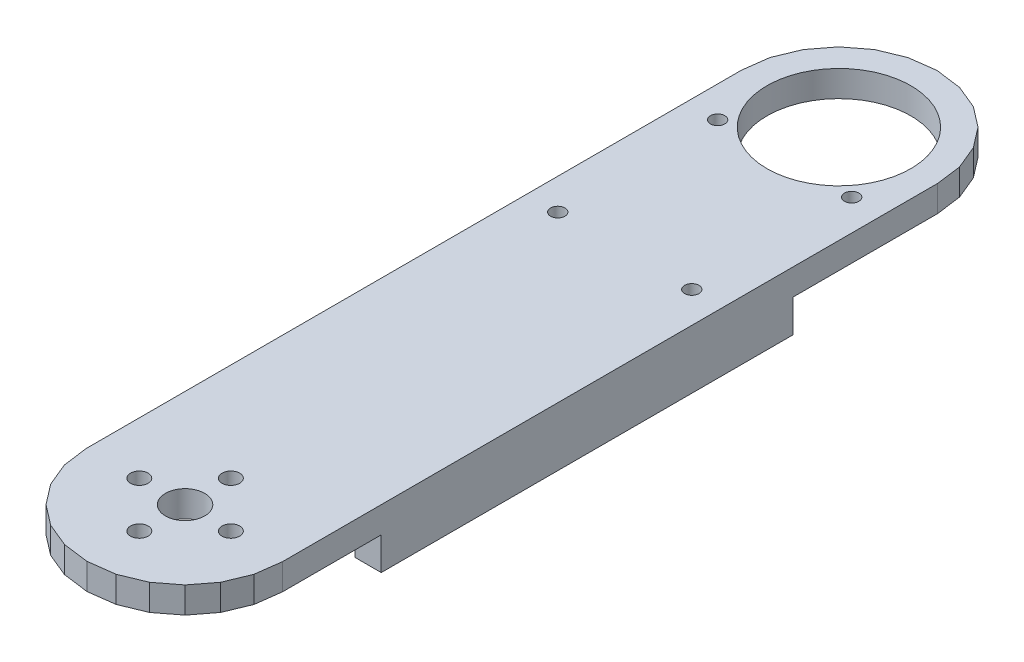
from build123d import *

# Parameters (mm, degrees)
BOSS_1_DEPTH  = 4
S_BOX2_W      = 4
S_BOX2_H      = 5.5
BOSS_2_DEPTH  = 63
S_BOX3_W      = 4
S_BOX3_H      = 5.5
BOSS_3_DEPTH  = 63
S_HOLE4_R     = 3
HOLE_4_DEPTH  = 4.2
S_HOLE5_R     = 1.35
HOLE_5_DEPTH  = 4.2
S_HOLE6_R     = 1.35
HOLE_6_DEPTH  = 4.2
S_HOLE7_R     = 1.35
HOLE_7_DEPTH  = 4.2
S_HOLE8_R     = 1.35
HOLE_8_DEPTH  = 4.2
S_HOLE9_R     = 11
HOLE_9_DEPTH  = 4.2
S_HOLE10_R    = 1.1
HOLE_10_DEPTH = 4.2
S_HOLE11_R    = 1.1
HOLE_11_DEPTH = 4.2
S_HOLE12_R    = 1.1
HOLE_12_DEPTH = 4.2
S_HOLE13_R    = 1.1
HOLE_13_DEPTH = 4.2


with BuildPart() as part:
    # S_prism1 → Boss_1 (new body)
    with BuildSketch(Plane(origin=(0, -20, 0), x_dir=(1, 0, 0), z_dir=(0, 1, 0))):
        Polygon((-15, -0.1), (-14.492, -3.956), (-13.004, -7.55), (-10.636, -10.636), (-7.55, -13.004), (-3.956, -14.492), (-0.1, -15), (0.1, -15), (3.956, -14.492), (7.55, -13.004), (10.636, -10.636), (13.004, -7.55), (14.492, -3.956), (15, -0.1), (15, 100.1), (14.492, 103.956), (13.004, 107.55), (10.636, 110.636), (7.55, 113.004), (3.956, 114.492), (0.1, 115), (-0.1, 115), (-3.956, 114.492), (-7.55, 113.004), (-10.636, 110.636), (-13.004, 107.55), (-14.492, 103.956), (-15, 100.1), align=None)
    extrude(amount=BOSS_1_DEPTH)

    # S_box2 → Boss_2 (add)
    with BuildSketch(Plane.XY.offset(-78)):
        with Locations((-13, -22.25)):
            Rectangle(S_BOX2_W, S_BOX2_H)
    extrude(amount=BOSS_2_DEPTH)

    # S_box3 → Boss_3 (add)
    with BuildSketch(Plane.XY.offset(-78)):
        with Locations((13, -22.25)):
            Rectangle(S_BOX3_W, S_BOX3_H)
    extrude(amount=BOSS_3_DEPTH)

    # S_hole4 → Hole_4 (cut)
    with BuildSketch(Plane(origin=(0, -20.1, 0), x_dir=(1, 0, 0), z_dir=(0, 1, 0))):
        Circle(S_HOLE4_R)
    extrude(amount=HOLE_4_DEPTH, mode=Mode.SUBTRACT)

    # S_hole5 → Hole_5 (cut)
    with BuildSketch(Plane(origin=(0, -20.1, 0), x_dir=(1, 0, 0), z_dir=(0, 1, 0))):
        with Locations((7, 0)):
            Circle(S_HOLE5_R)
    extrude(amount=HOLE_5_DEPTH, mode=Mode.SUBTRACT)

    # S_hole6 → Hole_6 (cut)
    with BuildSketch(Plane(origin=(0, -20.1, 0), x_dir=(1, 0, 0), z_dir=(0, 1, 0))):
        with Locations((0, -7)):
            Circle(S_HOLE6_R)
    extrude(amount=HOLE_6_DEPTH, mode=Mode.SUBTRACT)

    # S_hole7 → Hole_7 (cut)
    with BuildSketch(Plane(origin=(0, -20.1, 0), x_dir=(1, 0, 0), z_dir=(0, 1, 0))):
        with Locations((-7, 0)):
            Circle(S_HOLE7_R)
    extrude(amount=HOLE_7_DEPTH, mode=Mode.SUBTRACT)

    # S_hole8 → Hole_8 (cut)
    with BuildSketch(Plane(origin=(0, -20.1, 0), x_dir=(1, 0, 0), z_dir=(0, 1, 0))):
        with Locations((0, 7)):
            Circle(S_HOLE8_R)
    extrude(amount=HOLE_8_DEPTH, mode=Mode.SUBTRACT)

    # S_hole9 → Hole_9 (cut)
    with BuildSketch(Plane(origin=(0, -20.1, 0), x_dir=(1, 0, 0), z_dir=(0, 1, 0))):
        with Locations((0, 100)):
            Circle(S_HOLE9_R)
    extrude(amount=HOLE_9_DEPTH, mode=Mode.SUBTRACT)

    # S_hole10 → Hole_10 (cut)
    with BuildSketch(Plane(origin=(0, -20.1, 0), x_dir=(1, 0, 0), z_dir=(0, 1, 0))):
        with Locations((-10.25, 91.7)):
            Circle(S_HOLE10_R)
    extrude(amount=HOLE_10_DEPTH, mode=Mode.SUBTRACT)

    # S_hole11 → Hole_11 (cut)
    with BuildSketch(Plane(origin=(0, -20.1, 0), x_dir=(1, 0, 0), z_dir=(0, 1, 0))):
        with Locations((10.25, 91.7)):
            Circle(S_HOLE11_R)
    extrude(amount=HOLE_11_DEPTH, mode=Mode.SUBTRACT)

    # S_hole12 → Hole_12 (cut)
    with BuildSketch(Plane(origin=(0, -20.1, 0), x_dir=(1, 0, 0), z_dir=(0, 1, 0))):
        with Locations((-10.25, 67.25)):
            Circle(S_HOLE12_R)
    extrude(amount=HOLE_12_DEPTH, mode=Mode.SUBTRACT)

    # S_hole13 → Hole_13 (cut)
    with BuildSketch(Plane(origin=(0, -20.1, 0), x_dir=(1, 0, 0), z_dir=(0, 1, 0))):
        with Locations((10.25, 67.25)):
            Circle(S_HOLE13_R)
    extrude(amount=HOLE_13_DEPTH, mode=Mode.SUBTRACT)


solid = part.part
